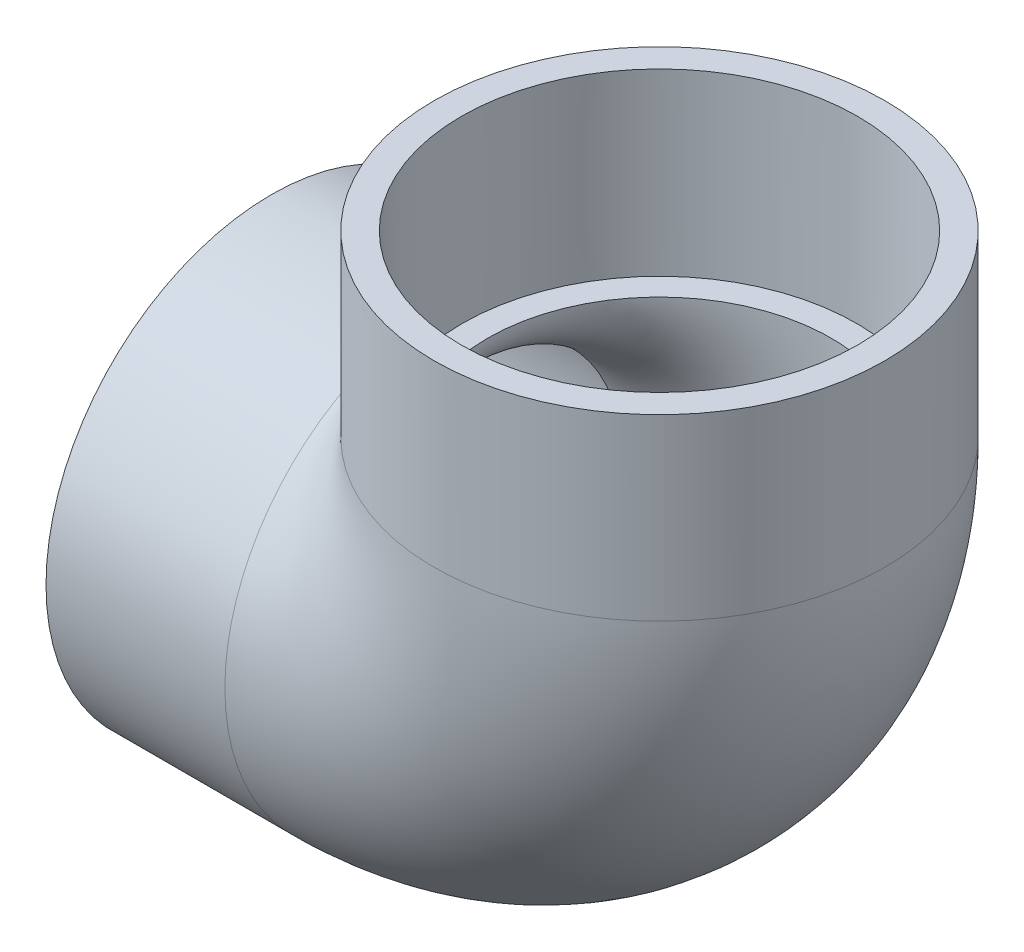
from build123d import *

# Parameters (mm, degrees)
SWEEP1_OUTLINE_R = 73.1647
SWEEP1_ANGLE     = 90


# Read off the part's stored shape, not the designer's step: Sweep1
with BuildPart() as part:
    # Sketch1 → Revolve1 (revolve)
    with BuildSketch(Plane.XY, mode=Mode.PRIVATE) as revolve1_sk:
        Polygon((-165.354, -96.012), (-89.154, -96.012), (-89.154, -83.9978), (-165.354, -84.4169), align=None)
    revolve(revolve1_sk.sketch.rotate(Axis((-165.354, 0, 0), (1, 0, 0)), 270), axis=Axis((-165.354, 0, 0), (1, 0, 0)))



with BuildPart() as body_2:
    # Sketch2 → Revolve2 (revolve)
    with BuildSketch(Plane.XY, mode=Mode.PRIVATE) as revolve2_sk:
        Polygon((84.4169, 165.354), (83.9978, 89.154), (96.012, 89.154), (96.012, 165.354), align=None)
    revolve(revolve2_sk.sketch.rotate(Axis((0, 0, 0), (0, 1, 0)), 90), axis=Axis((0, 0, 0), (0, 1, 0)))


with BuildPart() as part_1:
    add(part.part)

    add(body_2.part)  # Sweep1 merges body 2
    # Sweep1 outline → Sweep1 (revolve)
    with BuildSketch(Plane(origin=(-89.154, 89.154, 0), x_dir=(0, -1, 0), z_dir=(-1, 0, 0))):
        with BuildLine():
            add(Edge.make_bspline(
                [(0, -35.635213315), (7.226939391, -53.71594006), (20.070416067, -72.465803165), (39.975095396, -88.544685389), (65.337117117, -96.012000257), (102.72349088, -96.011999853), (115.975937675, -93.613983156), (128.02736495, -89.051276779), (138.456617079, -83.130185971), (159.448891106, -67.160197693), (170.994798879, -54.552008623), (180.43320521, -38.188701279), (189.871093451, 6.53e-07), (180.433204634, 38.188702281), (170.994798405, 54.55200914), (159.448890858, 67.160197881), (138.456616693, 83.130186265), (128.027364038, 89.051277297), (115.975936094, 93.613983754), (102.723488564, 96.012000273), (65.337114644, 96.011999522), (39.975093885, 88.544684189), (20.070415409, 72.465802201), (7.226939211, 53.71593961), (0, 35.635213315)],
                knots=[7.871790236, 7.871790236, 7.871790236, 7.871790236, 7.871790236, 7.871790236, 9.044526754, 9.044526754, 9.044526754, 9.044526754, 9.712684534, 9.712684534, 9.712684534, 9.712684534, 10.633131692, 10.633131692, 10.633131692, 11.553578831, 11.553578831, 11.553578831, 11.553578831, 12.22173664, 12.22173664, 12.22173664, 12.22173664, 13.394473129, 13.394473129, 13.394473129, 13.394473129, 13.394473129, 13.394473129], degree=5, weights=[1, 1, 0.993782066, 0.988985436, 1, 1, 0.999676217, 1.000117844, 1, 1, 0.998977466, 0.997064849, 1.002935151, 0.997064849, 0.998977467, 1, 1, 1.000117844, 0.999676217, 1, 1, 0.988985438, 0.993782067, 1, 1]))
            Line((0, 35.635213315), (0, -35.635213315))
        make_face()
        with Locations((89.154, 0)):
            Circle(SWEEP1_OUTLINE_R, mode=Mode.SUBTRACT)
    revolve(axis=Axis((-89.154, 89.154, 0), (0, 0, 1)), revolution_arc=SWEEP1_ANGLE)


solid = part_1.part
